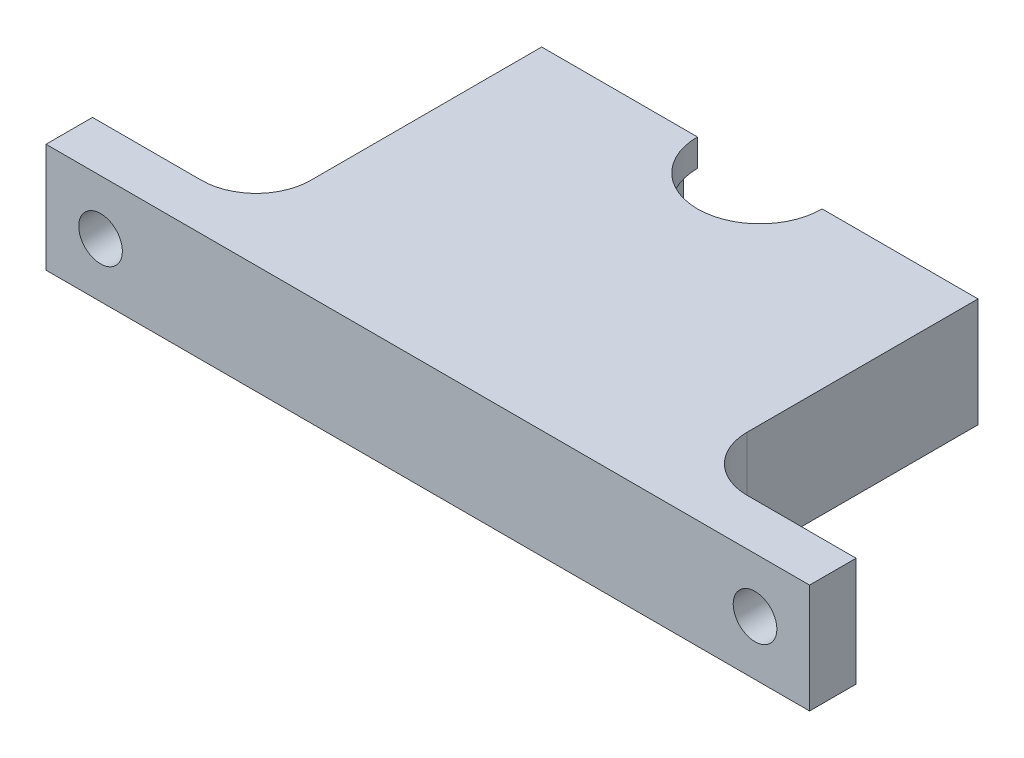
from build123d import *

# Parameters (mm, degrees)
MAIN_BODY_DEPTH       = 5
SKETCH3_R             = 6.985
BEARING_CUTOUT_DEPTH  = 2.5
SKETCH4_R             = 1.5
TOP_MOUNT_HOLES_DEPTH = 10
SKETCH6_W             = 15
SKETCH6_H             = 10
SKETCH6_R             = 2
MOUNTING_HOLES_DEPTH  = 4.2634
FILLET1_R             = 5


with BuildPart() as part:
    # Sketch1 → main body (new, symmetric)
    with BuildSketch(Plane(origin=(0, 0, 0), x_dir=(1, 0, 0), z_dir=(0, 1, 0))):
        with BuildLine():
            Line((20, 0), (12.7, 0))
            Line((12.7, 0), (5.715, 0))
            ThreePointArc((5.715, 0), (0, -5.715), (-5.715, 0))
            Line((-5.715, 0), (-12.7, 0))
            Line((-12.7, 0), (-20, 0))
            Line((-20, 0), (-20, -30.442))
            Line((-20, -30.442), (20, -30.442))
            Line((20, -30.442), (20, 0))
        make_face()
    extrude(amount=MAIN_BODY_DEPTH, both=True)

    # Sketch3 → bearing cutout (cut, symmetric)
    with BuildSketch(Plane(origin=(0, 0, 0), x_dir=(1, 0, 0), z_dir=(0, 1, 0))):
        Circle(SKETCH3_R)
    extrude(amount=BEARING_CUTOUT_DEPTH, both=True, mode=Mode.SUBTRACT)

    # Sketch4 → top mount holes (cut)
    with BuildSketch(Plane(origin=(0, 0, 0), x_dir=(-1, 0, 0), z_dir=(0, 0, -1))):
        with Locations((-15, 0)):
            Circle(SKETCH4_R)
        with Locations((15, 0)):
            Circle(SKETCH4_R)
    extrude(amount=-TOP_MOUNT_HOLES_DEPTH, mode=Mode.SUBTRACT)

    # Sketch6 → mounting holes (add)
    # profile 1 of 2: a face of its own
    with BuildSketch(Plane.XY.offset(30.442)):
        with Locations((-27.5, 0)):
            Rectangle(SKETCH6_W, SKETCH6_H)
        with Locations((-30, 0)):
            Circle(SKETCH6_R, mode=Mode.SUBTRACT)
    # profile 2 of 2: a face of its own
    with BuildSketch(Plane.XY.offset(30.442)):
        with Locations((27.5, 0)):
            Rectangle(SKETCH6_W, SKETCH6_H)
        with Locations((30, 0)):
            Circle(SKETCH6_R, mode=Mode.SUBTRACT)
    extrude(amount=-MOUNTING_HOLES_DEPTH)

    # Fillet1
    fillet1_edges = [part.edges().sort_by_distance(p)[0] for p in [
        (20, 0, 26.1786),
        (-20, 0, 26.1786),
    ]]
    fillet(fillet1_edges, radius=FILLET1_R)


solid = part.part
